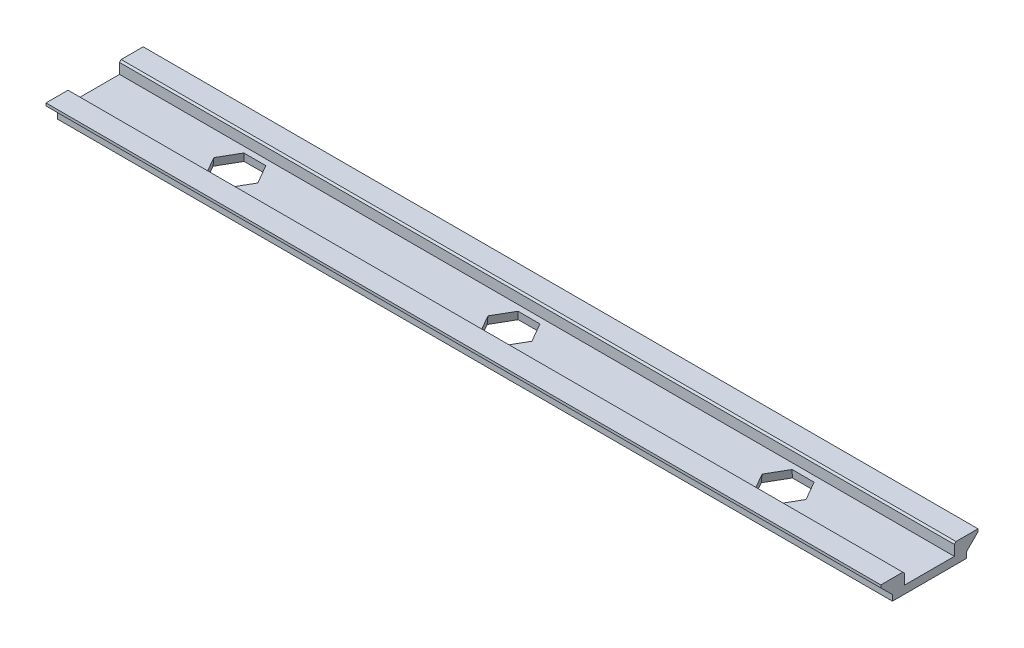
from build123d import *

# Parameters (mm, degrees)
BOSS_EXTRUDE1_DEPTH = 50.25
CUT_EXTRUDE2_DEPTH  = 51.646273308
CUT_EXTRUDE2_TAPER  = -5
CHAMFER1_SIZE       = 0.2


with BuildPart() as part:
    # Retainer Profile → Boss-Extrude1 (new, symmetric)
    with BuildSketch(Plane(origin=(0, 0, 0), x_dir=(0, 0, -1), z_dir=(1, 0, 0))):
        Polygon((-5.05, 4.592304845), (-5.85, 4.592304845), (-5.85, 4.275147558), (-4.45, 2.875147558), (-4.45, 2.192304845), (4.45, 2.192304845), (4.45, 2.875147558), (5.85, 4.275147558), (5.85, 4.592304845), (5.05, 4.592304845), (3, 4.592304845), (3, 3.142304845), (-3, 3.142304845), (-3, 4.592304845), align=None)
    extrude(amount=BOSS_EXTRUDE1_DEPTH, both=True)

    # Sketch3 → Cut-Extrude2 (cut, through all)
    with BuildSketch(Plane(origin=(0, 4.592304845, 0), x_dir=(1, 0, 0), z_dir=(0, 1, 0))):
        Polygon((35.25, 0), (34, 2.165063509), (31.5, 2.165063509), (30.25, 0), (31.5, -2.165063509), (34, -2.165063509), align=None)
        Polygon((2.25, 0), (1, 2.165063509), (-1.5, 2.165063509), (-2.75, 0), (-1.5, -2.165063509), (1, -2.165063509), align=None)
        Polygon((-30.75, 0), (-32, 2.165063509), (-34.5, 2.165063509), (-35.75, 0), (-34.5, -2.165063509), (-32, -2.165063509), align=None)
    extrude(amount=-CUT_EXTRUDE2_DEPTH, taper=CUT_EXTRUDE2_TAPER, mode=Mode.SUBTRACT)

    # Chamfer1
    chamfer1_edges = [part.edges().sort_by_distance(p)[0] for p in [
        (0, 4.592304845, 3),
        (0, 4.592304845, -3),
    ]]
    chamfer(chamfer1_edges, length=CHAMFER1_SIZE)


solid = part.part
